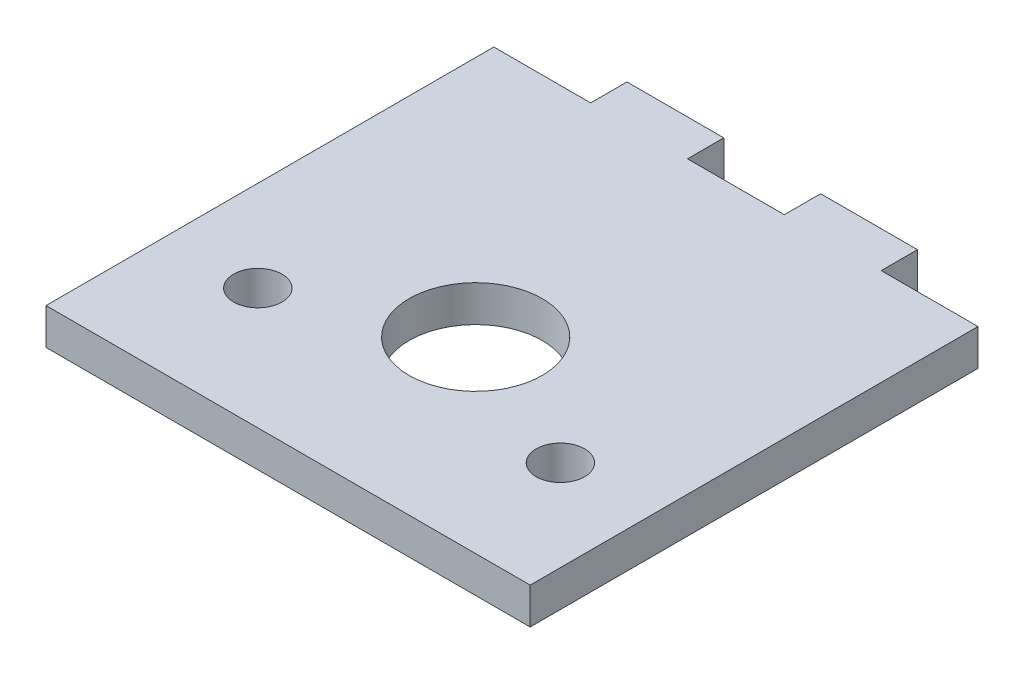
from build123d import *

# Parameters (mm, degrees)
SKETCH1_R           = 4
BOSS_EXTRUDE1_DEPTH = 6
CUT_EXTRUDE1_REACH  = 65.537
SKETCH2_R           = 11


with BuildPart() as part:
    # Sketch1 → Boss-Extrude1 (new body)
    with BuildSketch(Plane(origin=(0, 0, 0), x_dir=(1, 0, 0), z_dir=(0, 1, 0))):
        Polygon((-40, 43), (-24, 43), (-24, 49), (-8, 49), (-8, 43), (8, 43), (8, 49), (24, 49), (24, 43), (40, 43), (40, -31), (-40, -31), align=None)
        Circle(SKETCH1_R, mode=Mode.SUBTRACT)
        with Locations((25, -11)):
            Circle(SKETCH1_R, mode=Mode.SUBTRACT)
        with Locations((-25, -11)):
            Circle(SKETCH1_R, mode=Mode.SUBTRACT)
    extrude(amount=BOSS_EXTRUDE1_DEPTH)

    # Sketch2 → Cut-Extrude1 (cut, up to next)
    with BuildSketch(Plane(origin=(0, 6, 0), x_dir=(1, 0, 0), z_dir=(0, 1, 0)), mode=Mode.PRIVATE) as cut_extrude1_sk1:
        Circle(SKETCH2_R)
    cut_extrude1_tool1 = extrude(cut_extrude1_sk1.sketch, amount=-CUT_EXTRUDE1_REACH, mode=Mode.PRIVATE) & part.part
    add(cut_extrude1_tool1.solids().sort_by_distance((0, 6, 0))[0], mode=Mode.SUBTRACT)


solid = part.part
